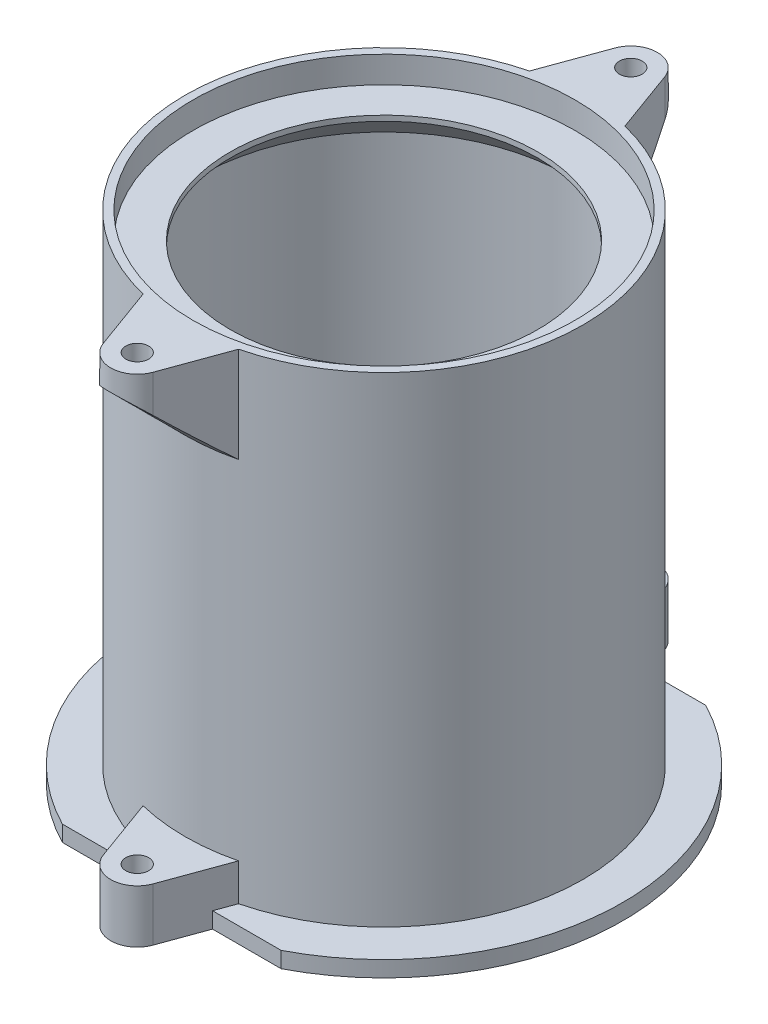
from build123d import *
from build123d.topology import SkipClean

# Parameters (mm, degrees)
SKETCH_1_R          = 37.5
SKETCH_1_R_2        = 29
EXTRUDE_1_DEPTH     = 4
SKETCH_2_R          = 37.5
SKETCH_2_R_2        = 36
EXTRUDE_2_DEPTH     = 5
EXTRUDE_START       = 84.5
SKETCH_3_R          = 37.5
SKETCH_3_R_2        = 29
EXTRUDE_3_DEPTH     = 84.5
SKETCH_4_W          = 100
SKETCH_4_H          = 80
SKETCH_4_R          = 37.5
EXTRUDE_4_DEPTH     = 3
SKETCH_5_R          = 5
SKETCH_5_R_2        = 2.15
EXTRUDE_5_DEPTH     = 93.5
EXTRUDE_5_2_DEPTH   = 93.5
EXTRUDE_START_2     = -3
EXTRUDE_6_DEPTH     = 93.5
SKETCH_8_R          = 35
CUT_EXTRUDE_1_DEPTH = 87.5
CHAMFER_1_SIZE      = 6
CUT_EXTRUDE_2_DEPTH = 116.509739972


with BuildPart() as part:
    # 草图1 → 凸台-拉伸1 (new body)
    with BuildSketch(Plane(origin=(0, 0, 0), x_dir=(1, 0, 0), z_dir=(0, 1, 0))):
        with Locations(Location((0, 0, 0), (0, 0, 270))):
            Circle(SKETCH_1_R)
        with Locations(Location((0, 0, 0), (0, 0, 270))):
            Circle(SKETCH_1_R_2, mode=Mode.SUBTRACT)
    extrude(amount=EXTRUDE_1_DEPTH)

    # 草图2 → 凸台-拉伸2 (add)
    with BuildSketch(Plane(origin=(0, 4, 0), x_dir=(1, 0, 0), z_dir=(0, 1, 0))):
        with Locations(Location((0, 0, 0), (0, 0, 270))):
            Circle(SKETCH_2_R)
        with Locations(Location((0, 0, 0), (0, 0, 270))):
            Circle(SKETCH_2_R_2, mode=Mode.SUBTRACT)
    extrude(amount=EXTRUDE_2_DEPTH)

    # 草图3 → 凸台-拉伸3 (add)
    with BuildSketch(Plane.XZ.offset(EXTRUDE_START)):
        with Locations(Location((0, 0, 0), (0, 0, 270))):
            Circle(SKETCH_3_R)
        with Locations(Location((0, 0, 0), (0, 0, 270))):
            Circle(SKETCH_3_R_2, mode=Mode.SUBTRACT)
    extrude(amount=-EXTRUDE_3_DEPTH)

    # 草图4 → 凸台-拉伸4 (add)
    with BuildSketch(Plane.XZ.offset(84.5)):
        Rectangle(SKETCH_4_W, SKETCH_4_H)
        with Locations(Location((0, 0, 0), (0, 0, 270))):
            Circle(SKETCH_4_R, mode=Mode.SUBTRACT)
    extrude(amount=-EXTRUDE_4_DEPTH)

    # 草图6 → 凸台-拉伸6 (add)
    with SkipClean():  # the faces are left unmerged after this step: merging them gives an invalid solid
        with BuildSketch(Plane(origin=(0, -81.5, 0), x_dir=(1, 0, 0), z_dir=(0, 1, 0)).offset(EXTRUDE_START_2)):
            with BuildLine():
                Line((-4.698463104, 48.210100717), (-8.995097405, 36.405194996))
                ThreePointArc((-8.995097405, 36.405194996), (0, 37.5), (8.995097405, 36.405194996))
                Line((8.995097405, 36.405194996), (4.698463104, 48.210100717))
                ThreePointArc((4.698463104, 48.210100717), (0, 41.5), (-4.698463104, 48.210100717))
            make_face()
            with BuildLine():
                Line((4.698463104, -48.210100717), (8.995097405, -36.405194996))
                ThreePointArc((8.995097405, -36.405194996), (0, -37.5), (-8.995097405, -36.405194996))
                Line((-8.995097405, -36.405194996), (-4.698463104, -48.210100717))
                ThreePointArc((-4.698463104, -48.210100717), (0, -41.5), (4.698463104, -48.210100717))
            make_face()
        extrude(amount=EXTRUDE_6_DEPTH)


with BuildPart() as body_2:
    # 草图5 → 凸台-拉伸5 (new body)
    with BuildSketch(Plane.XZ.offset(84.5)):
        with Locations(Location((0, 46.5, 0), (0, 0, 270))):
            Circle(SKETCH_5_R)
        with Locations(Location((0, 46.5, 0), (0, 0, 270))):
            Circle(SKETCH_5_R_2, mode=Mode.SUBTRACT)
    extrude(amount=-EXTRUDE_5_DEPTH)


with BuildPart() as body_3:
    # 草图5 → Extrude 5 2 (new body)
    with BuildSketch(Plane.XZ.offset(84.5)):
        with Locations(Location((0, -46.5, 0), (0, 0, 270))):
            Circle(SKETCH_5_R)
        with Locations(Location((0, -46.5, 0), (0, 0, 270))):
            Circle(SKETCH_5_R_2, mode=Mode.SUBTRACT)
    extrude(amount=-EXTRUDE_5_2_DEPTH)

    # Combine 2: union body 2, part
    add(body_2.part)
    add(part.part)

    # 草图8 → 切除-拉伸1 (cut)
    with BuildSketch(Plane.XZ.offset(84.5)):
        with Locations(Location((0, 0, 0), (0, 0, 270))):
            Circle(SKETCH_8_R)
    extrude(amount=-CUT_EXTRUDE_1_DEPTH, mode=Mode.SUBTRACT)

    # 倒角1
    chamfer_1_edges = [body_3.edges().sort_by_distance(p)[0] for p in [
        (0, 3, 35),
    ]]
    chamfer(chamfer_1_edges, length=CHAMFER_1_SIZE - 0.0001)  # a hair under: the kernel refuses the full size

    # 草图9 → 切除-旋转1 (revolve, cut)
    with BuildSketch(Plane.XY, mode=Mode.PRIVATE) as cut_revolve_1_sk:
        Polygon((-37.5, -9), (-60, 13.5), (-60, -74.5), (-37.5, -74.5), align=None)
    revolve(cut_revolve_1_sk.sketch.rotate(Axis((0, 9, 0), (0, -1, 0)), 76.121175643), axis=Axis((0, 9, 0), (0, -1, 0)), mode=Mode.SUBTRACT)

    # 草图11 → 切除-拉伸2 (cut, through all)
    with BuildSketch(Plane(origin=(0, -81.5, 0), x_dir=(1, 0, 0), z_dir=(0, 1, 0))):
        with BuildLine():
            Line((-20.615528128, 40), (-50, 40))
            Line((-50, 40), (-50, -40))
            Line((-50, -40), (-20.615528128, -40))
            ThreePointArc((-20.615528128, -40), (-45, 0), (-20.615528128, 40))
        make_face()
        with BuildLine():
            Line((20.615528128, 40), (50, 40))
            Line((50, 40), (50, -40))
            Line((50, -40), (20.615528128, -40))
            ThreePointArc((20.615528128, -40), (45, 0), (20.615528128, 40))
        make_face()
    extrude(amount=-CUT_EXTRUDE_2_DEPTH, mode=Mode.SUBTRACT)


solid = body_3.part
